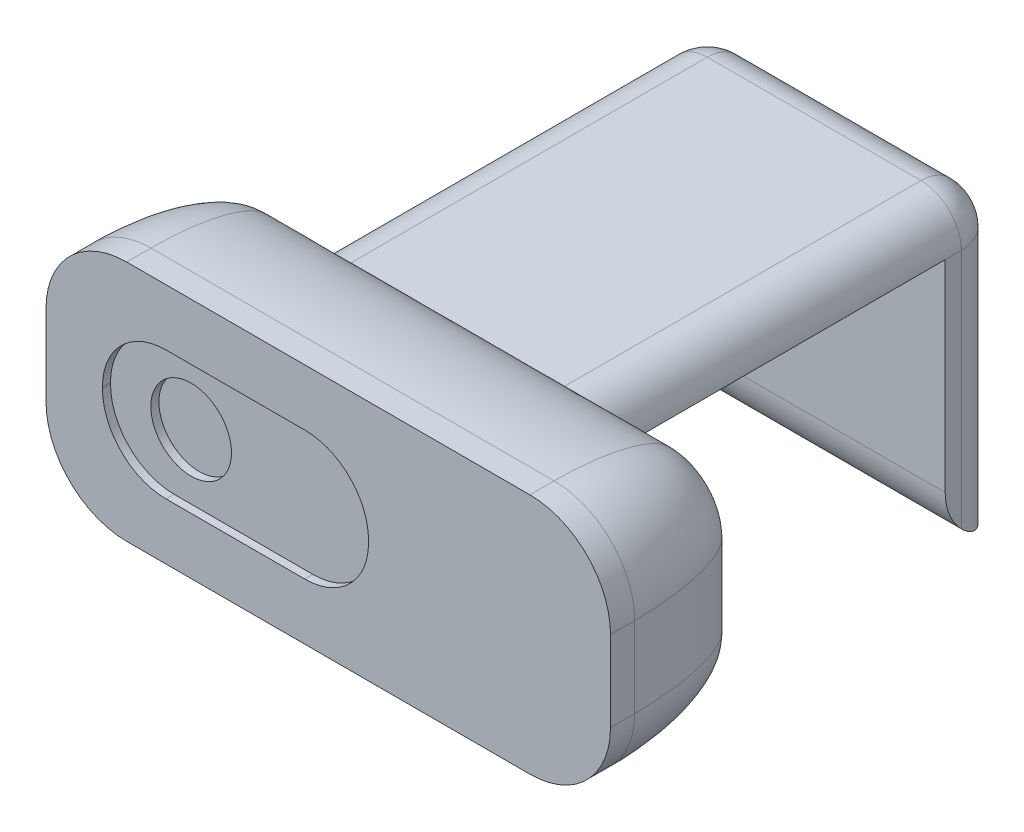
from build123d import *

# Parameters (mm, degrees)
RESSALTO_EXTRUS_O1_DEPTH = 18
FILETE1_SIZE             = 15
FILETE1_SIZE_2           = 5
ESBO_O2_R                = 5
CORTE_EXTRUS_O1_DEPTH    = 2
CORTE_EXTRUS_O2_DEPTH    = 1
ESBO_O4_W                = 36.5
ESBO_O4_H                = 5
RESSALTO_EXTRUS_O2_DEPTH = 55
FILETE2_R                = 5
ESBO_O5_W                = 36.5
ESBO_O5_H                = 7
RESSALTO_EXTRUS_O3_DEPTH = 32
FILETE3_R                = 5
FILETE4_R                = 7


# Some blends are built 0.0001 mm under size
with BuildPart() as part:
    # Esboço1 → Ressalto-extrusão1 (new body)
    with BuildSketch(Plane.XY):
        with BuildLine():
            Line((-25, -15), (25, -15))
            ThreePointArc((25, -15), (32.071067812, -12.071067812), (35, -5))
            Line((35, -5), (35, 5))
            ThreePointArc((35, 5), (32.071067812, 12.071067812), (25, 15))
            Line((25, 15), (-25, 15))
            ThreePointArc((-25, 15), (-32.071067812, 12.071067812), (-35, 5))
            Line((-35, 5), (-35, -5))
            ThreePointArc((-35, -5), (-32.071067812, -12.071067812), (-25, -15))
        make_face()
    extrude(amount=RESSALTO_EXTRUS_O1_DEPTH)

    # Filete1
    # an asymmetric fillet: 15, 5 mm, written as the material it takes off along each edge
    with BuildSketch(Plane(origin=(25, 15, 0), x_dir=(0, 0, 1), z_dir=(-1, 0, 0)), Plane(origin=(-25, -15, 0), x_dir=(0, 0, 1), z_dir=(1, 0, 0))) as filete1_piece_1:
        with BuildLine():
            Bezier((FILETE1_SIZE, 0), (0, 0), (0, -FILETE1_SIZE_2), weights=[1, 0.707106781, 1])
            Line((0, -FILETE1_SIZE_2), (0, 0))
            Line((0, 0), (FILETE1_SIZE, 0))
        make_face()
    extrude(amount=50, mode=Mode.SUBTRACT)
    with BuildSketch(Plane(origin=(25, 5, 0), x_dir=(1, 0, 0), z_dir=(0, -1, 0))) as filete1_piece_2:
        with BuildLine():
            Bezier((10, FILETE1_SIZE), (10, 0), (10 - FILETE1_SIZE_2, 0), weights=[1, 0.707106781, 1])
            Line((10 - FILETE1_SIZE_2, 0), (10, 0))
            Line((10, 0), (10, FILETE1_SIZE))
        make_face()
    revolve(axis=Axis((25, 5, 0), (0, 0, 1)), revolution_arc=90, mode=Mode.SUBTRACT)
    with BuildSketch(Plane(origin=(35, -5, 0), x_dir=(0, 0, 1), z_dir=(0, 1, 0)), Plane(origin=(-35, 5, 0), x_dir=(0, 0, 1), z_dir=(0, -1, 0))) as filete1_piece_3:
        with BuildLine():
            Bezier((FILETE1_SIZE, 0), (0, 0), (0, -FILETE1_SIZE_2), weights=[1, 0.707106781, 1])
            Line((0, -FILETE1_SIZE_2), (0, 0))
            Line((0, 0), (FILETE1_SIZE, 0))
        make_face()
    extrude(amount=10, mode=Mode.SUBTRACT)
    with BuildSketch(Plane(origin=(25, -5, 0), x_dir=(0, -1, 0), z_dir=(-1, 0, 0))) as filete1_piece_4:
        with BuildLine():
            Bezier((10, FILETE1_SIZE), (10, 0), (10 - FILETE1_SIZE_2, 0), weights=[1, 0.707106781, 1])
            Line((10 - FILETE1_SIZE_2, 0), (10, 0))
            Line((10, 0), (10, FILETE1_SIZE))
        make_face()
    revolve(axis=Axis((25, -5, 0), (0, 0, 1)), revolution_arc=90, mode=Mode.SUBTRACT)
    with BuildSketch(Plane(origin=(-25, -5, 0), x_dir=(-1, 0, 0), z_dir=(0, 1, 0))) as filete1_piece_5:
        with BuildLine():
            Bezier((10, FILETE1_SIZE), (10, 0), (10 - FILETE1_SIZE_2, 0), weights=[1, 0.707106781, 1])
            Line((10 - FILETE1_SIZE_2, 0), (10, 0))
            Line((10, 0), (10, FILETE1_SIZE))
        make_face()
    revolve(axis=Axis((-25, -5, 0), (0, 0, 1)), revolution_arc=90, mode=Mode.SUBTRACT)
    with BuildSketch(Plane(origin=(-25, 5, 0), x_dir=(0, 1, 0), z_dir=(1, 0, 0))) as filete1_piece_6:
        with BuildLine():
            Bezier((10, FILETE1_SIZE), (10, 0), (10 - FILETE1_SIZE_2, 0), weights=[1, 0.707106781, 1])
            Line((10 - FILETE1_SIZE_2, 0), (10, 0))
            Line((10, 0), (10, FILETE1_SIZE))
        make_face()
    revolve(axis=Axis((-25, 5, 0), (0, 0, 1)), revolution_arc=90, mode=Mode.SUBTRACT)

    # Esboço2 → Corte-extrusão1 (cut)
    with BuildSketch(Plane.XY.offset(18)):
        with Locations((-18, 0)):
            Circle(ESBO_O2_R)
    extrude(amount=-CORTE_EXTRUS_O1_DEPTH, mode=Mode.SUBTRACT)

    # Esboço3 → Corte-extrusão2 (cut)
    with BuildSketch(Plane.XY.offset(18)):
        with BuildLine():
            Line((-2.9, -8), (-20.1, -8))
            ThreePointArc((-20.1, -8), (-25.686143571, -5.686143571), (-28, -0.1))
            Line((-28, -0.1), (-28, 0.1))
            ThreePointArc((-28, 0.1), (-25.686143571, 5.686143571), (-20.1, 8))
            Line((-20.1, 8), (-2.9, 8))
            ThreePointArc((-2.9, 8), (2.686143571, 5.686143571), (5, 0.1))
            Line((5, 0.1), (5, -0.1))
            ThreePointArc((5, -0.1), (2.686143571, -5.686143571), (-2.9, -8))
        make_face()
    extrude(amount=-CORTE_EXTRUS_O2_DEPTH, mode=Mode.SUBTRACT)

    # Esboço4 → Ressalto-extrusão2 (add)
    with BuildSketch(Plane(origin=(0, 0, 0), x_dir=(-1, 0, 0), z_dir=(0, 0, -1))):
        with Locations((7.75, 2.5)):
            Rectangle(ESBO_O4_W, ESBO_O4_H)
    extrude(amount=RESSALTO_EXTRUS_O2_DEPTH)

    # Filete2
    filete2_edges = [part.edges().sort_by_distance(p)[0] for p in [
        (-26, 5, -27.5),
        (10.5, 5, -27.5),
    ]]
    fillet(filete2_edges, radius=FILETE2_R - 0.0001)  # a hair under: the kernel refuses the full size

    # Esboço5 → Ressalto-extrusão3 (add)
    with BuildSketch(Plane.XZ):
        with Locations((-7.75, -51.5)):
            Rectangle(ESBO_O5_W, ESBO_O5_H)
    extrude(amount=RESSALTO_EXTRUS_O3_DEPTH)

    # Filete3
    filete3_edges = [part.edges().sort_by_distance(p)[0] for p in [
        (-7.75, 5, -55),
        (9.035563195, 3.535563195, -55),
        (-24.535563195, 3.535563195, -55),
        (-26, -15.99995, -55),
        (10.5, -15.99995, -55),
    ]]
    fillet(filete3_edges, radius=FILETE3_R - 0.0001)  # a hair under: the kernel refuses the full size

    # Filete4
    filete4_edges = [part.edges().sort_by_distance(p)[0] for p in [
        (-7.75, -32, -48),
    ]]
    fillet(filete4_edges, radius=FILETE4_R - 0.0001)  # a hair under: the kernel refuses the full size


solid = part.part
